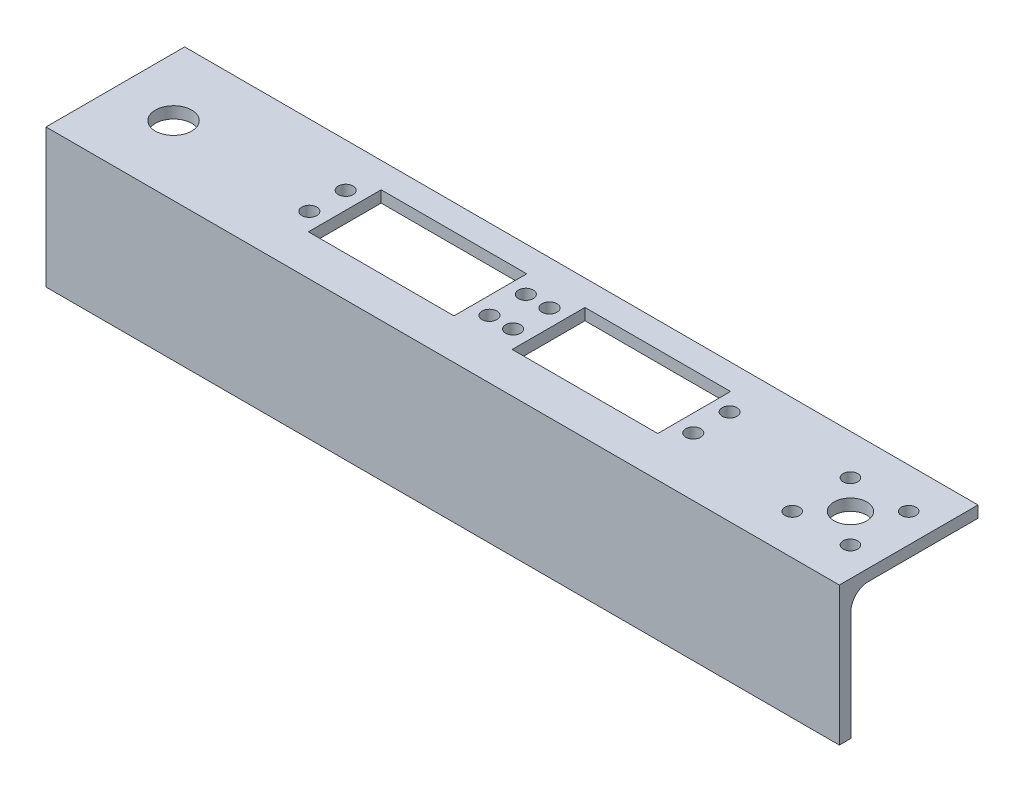
from build123d import *

# Parameters (mm, degrees)
BASE_ANGLE_PROFILE_DEPTH     = 109
SKETCH2_R                    = 2.05
SKETCH2_W                    = 40
SKETCH2_H                    = 20
SERVO_MOUNT_PATTERN_DEPTH    = 122.590377909
INTERNAL_FILLET_R            = 4.7752
SKETCH3_R                    = 4.5
SKETCH3_R_2                  = 2
LEAD_SCREW_NUT_PATTERN_DEPTH = 304.8
SKETCH4_R                    = 5
CUT_EXTRUDE3_DEPTH           = 122.590377909


with BuildPart() as part:
    # Sketch1 → Base Angle Profile (new, symmetric)
    with BuildSketch(Plane(origin=(0, 0, 0), x_dir=(0, 0, -1), z_dir=(1, 0, 0))):
        Polygon((0, 0), (38.1, 0), (38.1, -3.175), (3.175, -3.175), (3.175, -38.1), (0, -38.1), align=None)
    extrude(amount=BASE_ANGLE_PROFILE_DEPTH, both=True)

    # Sketch2 → Servo Mount Pattern (cut, through all)
    with BuildSketch(Plane(origin=(0, 0, 0), x_dir=(1, 0, 0), z_dir=(0, 1, 0))):
        with Locations((-52.75, 26.1)):
            Circle(SKETCH2_R)
        with Locations((-52.75, 16.1)):
            Circle(SKETCH2_R)
        with Locations((-3.25, 26.1)):
            Circle(SKETCH2_R)
        with Locations((-3.25, 16.1)):
            Circle(SKETCH2_R)
        with Locations((3.25, 16.1)):
            Circle(SKETCH2_R)
        with Locations((3.25, 26.1)):
            Circle(SKETCH2_R)
        with Locations((52.75, 26.1)):
            Circle(SKETCH2_R)
        with Locations((52.75, 16.1)):
            Circle(SKETCH2_R)
        with Locations((-28, 21.1)):
            Rectangle(SKETCH2_W, SKETCH2_H)
        with Locations((28, 21.1)):
            Rectangle(SKETCH2_W, SKETCH2_H)
    extrude(amount=-SERVO_MOUNT_PATTERN_DEPTH, mode=Mode.SUBTRACT)

    # Internal Fillet
    internal_fillet_edges = [part.edges().sort_by_distance(p)[0] for p in [
        (0, -3.175, -3.175),
    ]]
    fillet(internal_fillet_edges, radius=INTERNAL_FILLET_R)

    # Sketch3 → Lead Screw Nut Pattern (cut)
    with BuildSketch(Plane(origin=(0, 0, 0), x_dir=(1, 0, 0), z_dir=(0, 1, 0))):
        with Locations((93, 19.05)):
            Circle(SKETCH3_R)
        with Locations((101, 27.05)):
            Circle(SKETCH3_R_2)
        with Locations((85, 27.05)):
            Circle(SKETCH3_R_2)
        with Locations((85, 11.05)):
            Circle(SKETCH3_R_2)
        with Locations((101, 11.05)):
            Circle(SKETCH3_R_2)
    extrude(amount=-LEAD_SCREW_NUT_PATTERN_DEPTH, mode=Mode.SUBTRACT)

    # Sketch4 → Cut-Extrude3 (cut, through all)
    with BuildSketch(Plane(origin=(0, 0, 0), x_dir=(1, 0, 0), z_dir=(0, 1, 0))):
        with Locations((-93, 19.05)):
            Circle(SKETCH4_R)
    extrude(amount=-CUT_EXTRUDE3_DEPTH, mode=Mode.SUBTRACT)


solid = part.part
